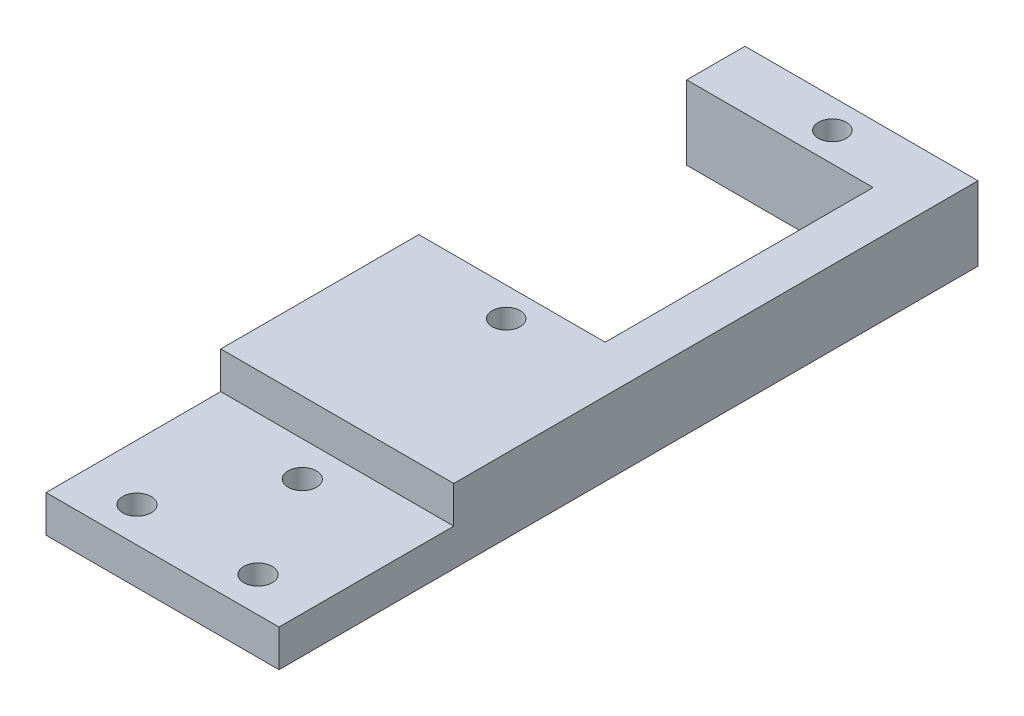
from build123d import *

# Parameters (mm, degrees)
SKETCH2_W             = 20
SKETCH2_H             = 60
BOSS_EXTRUDE1_DEPTH   = 6.35
SKETCH4_W             = 16
SKETCH4_H             = 23
CUT_EXTRUDE1_DEPTH    = 64.563531211
M2_CLEARANCE_HOLE1_D  = 2.4
SKETCH10_W            = 15
SKETCH10_H            = 3.175
CUT_EXTRUDE2_DEPTH    = 64.563531211
F_2_CLEARANCE_HOLE1_D = 2.4384


with BuildPart() as part:
    # Sketch2 → Boss-Extrude1 (new body)
    with BuildSketch(Plane(origin=(0, 0, 0), x_dir=(1, 0, 0), z_dir=(0, 1, 0))):
        with Locations((10, -30)):
            Rectangle(SKETCH2_W, SKETCH2_H)
    extrude(amount=BOSS_EXTRUDE1_DEPTH)

    # Sketch4 → Cut-Extrude1 (cut, through all)
    with BuildSketch(Plane(origin=(0, 6.35, 0), x_dir=(1, 0, 0), z_dir=(0, 1, 0))):
        with Locations((8, -16.5)):
            Rectangle(SKETCH4_W, SKETCH4_H)
    extrude(amount=-CUT_EXTRUDE1_DEPTH, mode=Mode.SUBTRACT)

    # M2 Clearance Hole1 (through all)
    with Locations(Plane(origin=(0, 6.35, 0), x_dir=(1, 0, 0), z_dir=(0, 1, 0))):
        with Locations((10, -30.5), (10, -2.5)):
            Hole(M2_CLEARANCE_HOLE1_D / 2)

    # Sketch10 → Cut-Extrude2 (cut, through all)
    with BuildSketch(Plane(origin=(20, 0, 0), x_dir=(0, 0, -1), z_dir=(1, 0, 0))):
        with Locations((-52.5, 4.7625)):
            Rectangle(SKETCH10_W, SKETCH10_H)
    extrude(amount=-CUT_EXTRUDE2_DEPTH, mode=Mode.SUBTRACT)

    # #2 Clearance Hole1 (through all)
    with Locations(Plane(origin=(0, 3.175, 0), x_dir=(1, 0, 0), z_dir=(0, 1, 0))):
        with Locations((10, -48), (4.803847577, -57), (15.196152423, -57)):
            Hole(F_2_CLEARANCE_HOLE1_D / 2)


solid = part.part
